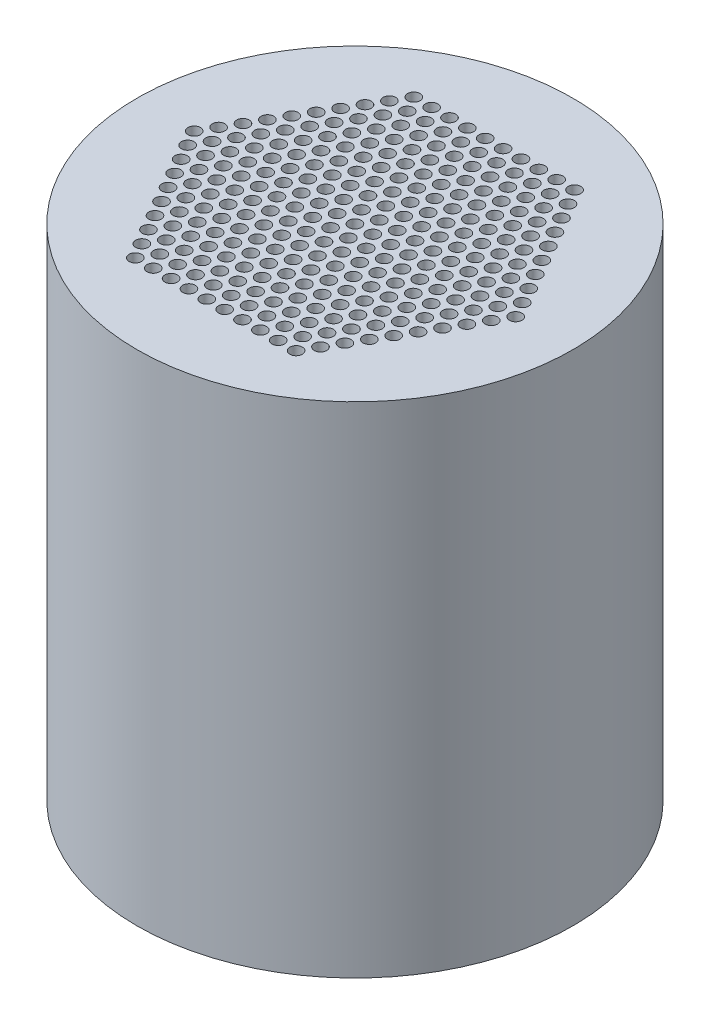
from build123d import *

# Parameters (mm, degrees)
ESBO_O1_R   = 610
AGUA_DEPTH  = 1397
ESBO_O2_R   = 17.5
VACUO_DEPTH = 1231.9


with BuildPart() as part:
    # Esboço1 → agua (new body)
    with BuildSketch(Plane(origin=(0, 0, 0), x_dir=(1, 0, 0), z_dir=(0, 1, 0))):
        Circle(ESBO_O1_R)
    extrude(amount=AGUA_DEPTH)

    # Esboço2 → vacuo (cut)
    with BuildSketch(Plane(origin=(0, 1397, 0), x_dir=(1, 0, 0), z_dir=(0, 1, 0))):
        Circle(ESBO_O2_R)
        with Locations((-25, 43.301270189)):
            Circle(ESBO_O2_R)
        with Locations((0, 86.602540378)):
            Circle(ESBO_O2_R)
        with Locations((-25, 129.903810568)):
            Circle(ESBO_O2_R)
        with Locations((25, 129.903810568)):
            Circle(ESBO_O2_R)
        with Locations((0, 173.205080757)):
            Circle(ESBO_O2_R)
        with Locations((25, 43.301270189)):
            Circle(ESBO_O2_R)
        with Locations((-25, 216.506350946)):
            Circle(ESBO_O2_R)
        with Locations((25, 216.506350946)):
            Circle(ESBO_O2_R)
        with Locations((0, 259.807621135)):
            Circle(ESBO_O2_R)
        with Locations((-25, 303.108891325)):
            Circle(ESBO_O2_R)
        with Locations((25, 303.108891325)):
            Circle(ESBO_O2_R)
        with Locations((0, 346.410161514)):
            Circle(ESBO_O2_R)
        with Locations((-25, 389.711431703)):
            Circle(ESBO_O2_R)
        with Locations((25, 389.711431703)):
            Circle(ESBO_O2_R)
        with Locations((50, 0)):
            Circle(ESBO_O2_R)
        with Locations((100, 0)):
            Circle(ESBO_O2_R)
        with Locations((150, 0)):
            Circle(ESBO_O2_R)
        with Locations((200, 0)):
            Circle(ESBO_O2_R)
        with Locations((250, 0)):
            Circle(ESBO_O2_R)
        with Locations((300, 0)):
            Circle(ESBO_O2_R)
        with Locations((350, 0)):
            Circle(ESBO_O2_R)
        with Locations((400, 0)):
            Circle(ESBO_O2_R)
        with Locations((450, 0)):
            Circle(ESBO_O2_R)
        with Locations((75, 43.301270189)):
            Circle(ESBO_O2_R)
        with Locations((50, 86.602540378)):
            Circle(ESBO_O2_R)
        with Locations((125, 43.301270189)):
            Circle(ESBO_O2_R)
        with Locations((100, 86.602540378)):
            Circle(ESBO_O2_R)
        with Locations((175, 43.301270189)):
            Circle(ESBO_O2_R)
        with Locations((150, 86.602540378)):
            Circle(ESBO_O2_R)
        with Locations((225, 43.301270189)):
            Circle(ESBO_O2_R)
        with Locations((200, 86.602540378)):
            Circle(ESBO_O2_R)
        with Locations((275, 43.301270189)):
            Circle(ESBO_O2_R)
        with Locations((250, 86.602540378)):
            Circle(ESBO_O2_R)
        with Locations((325, 43.301270189)):
            Circle(ESBO_O2_R)
        with Locations((300, 86.602540378)):
            Circle(ESBO_O2_R)
        with Locations((375, 43.301270189)):
            Circle(ESBO_O2_R)
        with Locations((350, 86.602540378)):
            Circle(ESBO_O2_R)
        with Locations((425, 43.301270189)):
            Circle(ESBO_O2_R)
        with Locations((400, 86.602540378)):
            Circle(ESBO_O2_R)
        with Locations((75, 129.903810568)):
            Circle(ESBO_O2_R)
        with Locations((50, 173.205080757)):
            Circle(ESBO_O2_R)
        with Locations((125, 129.903810568)):
            Circle(ESBO_O2_R)
        with Locations((100, 173.205080757)):
            Circle(ESBO_O2_R)
        with Locations((175, 129.903810568)):
            Circle(ESBO_O2_R)
        with Locations((150, 173.205080757)):
            Circle(ESBO_O2_R)
        with Locations((225, 129.903810568)):
            Circle(ESBO_O2_R)
        with Locations((200, 173.205080757)):
            Circle(ESBO_O2_R)
        with Locations((275, 129.903810568)):
            Circle(ESBO_O2_R)
        with Locations((250, 173.205080757)):
            Circle(ESBO_O2_R)
        with Locations((325, 129.903810568)):
            Circle(ESBO_O2_R)
        with Locations((300, 173.205080757)):
            Circle(ESBO_O2_R)
        with Locations((375, 129.903810568)):
            Circle(ESBO_O2_R)
        with Locations((350, 173.205080757)):
            Circle(ESBO_O2_R)
        with Locations((75, 216.506350946)):
            Circle(ESBO_O2_R)
        with Locations((50, 259.807621135)):
            Circle(ESBO_O2_R)
        with Locations((125, 216.506350946)):
            Circle(ESBO_O2_R)
        with Locations((100, 259.807621135)):
            Circle(ESBO_O2_R)
        with Locations((175, 216.506350946)):
            Circle(ESBO_O2_R)
        with Locations((150, 259.807621135)):
            Circle(ESBO_O2_R)
        with Locations((225, 216.506350946)):
            Circle(ESBO_O2_R)
        with Locations((200, 259.807621135)):
            Circle(ESBO_O2_R)
        with Locations((275, 216.506350946)):
            Circle(ESBO_O2_R)
        with Locations((250, 259.807621135)):
            Circle(ESBO_O2_R)
        with Locations((325, 216.506350946)):
            Circle(ESBO_O2_R)
        with Locations((300, 259.807621135)):
            Circle(ESBO_O2_R)
        with Locations((75, 303.108891325)):
            Circle(ESBO_O2_R)
        with Locations((50, 346.410161514)):
            Circle(ESBO_O2_R)
        with Locations((125, 303.108891325)):
            Circle(ESBO_O2_R)
        with Locations((100, 346.410161514)):
            Circle(ESBO_O2_R)
        with Locations((175, 303.108891325)):
            Circle(ESBO_O2_R)
        with Locations((150, 346.410161514)):
            Circle(ESBO_O2_R)
        with Locations((225, 303.108891325)):
            Circle(ESBO_O2_R)
        with Locations((200, 346.410161514)):
            Circle(ESBO_O2_R)
        with Locations((275, 303.108891325)):
            Circle(ESBO_O2_R)
        with Locations((250, 346.410161514)):
            Circle(ESBO_O2_R)
        with Locations((75, 389.711431703)):
            Circle(ESBO_O2_R)
        with Locations((125, 389.711431703)):
            Circle(ESBO_O2_R)
        with Locations((175, 389.711431703)):
            Circle(ESBO_O2_R)
        with Locations((225, 389.711431703)):
            Circle(ESBO_O2_R)
        with Locations((-225, 389.711431703)):
            Circle(ESBO_O2_R)
        with Locations((-175, 389.711431703)):
            Circle(ESBO_O2_R)
        with Locations((-125, 389.711431703)):
            Circle(ESBO_O2_R)
        with Locations((-75, 389.711431703)):
            Circle(ESBO_O2_R)
        with Locations((-250, 346.410161514)):
            Circle(ESBO_O2_R)
        with Locations((-275, 303.108891325)):
            Circle(ESBO_O2_R)
        with Locations((-200, 346.410161514)):
            Circle(ESBO_O2_R)
        with Locations((-225, 303.108891325)):
            Circle(ESBO_O2_R)
        with Locations((-150, 346.410161514)):
            Circle(ESBO_O2_R)
        with Locations((-175, 303.108891325)):
            Circle(ESBO_O2_R)
        with Locations((-100, 346.410161514)):
            Circle(ESBO_O2_R)
        with Locations((-125, 303.108891325)):
            Circle(ESBO_O2_R)
        with Locations((-50, 346.410161514)):
            Circle(ESBO_O2_R)
        with Locations((-75, 303.108891325)):
            Circle(ESBO_O2_R)
        with Locations((-300, 259.807621135)):
            Circle(ESBO_O2_R)
        with Locations((-325, 216.506350946)):
            Circle(ESBO_O2_R)
        with Locations((-250, 259.807621135)):
            Circle(ESBO_O2_R)
        with Locations((-275, 216.506350946)):
            Circle(ESBO_O2_R)
        with Locations((-200, 259.807621135)):
            Circle(ESBO_O2_R)
        with Locations((-225, 216.506350946)):
            Circle(ESBO_O2_R)
        with Locations((-150, 259.807621135)):
            Circle(ESBO_O2_R)
        with Locations((-175, 216.506350946)):
            Circle(ESBO_O2_R)
        with Locations((-100, 259.807621135)):
            Circle(ESBO_O2_R)
        with Locations((-125, 216.506350946)):
            Circle(ESBO_O2_R)
        with Locations((-50, 259.807621135)):
            Circle(ESBO_O2_R)
        with Locations((-75, 216.506350946)):
            Circle(ESBO_O2_R)
        with Locations((-350, 173.205080757)):
            Circle(ESBO_O2_R)
        with Locations((-375, 129.903810568)):
            Circle(ESBO_O2_R)
        with Locations((-300, 173.205080757)):
            Circle(ESBO_O2_R)
        with Locations((-325, 129.903810568)):
            Circle(ESBO_O2_R)
        with Locations((-250, 173.205080757)):
            Circle(ESBO_O2_R)
        with Locations((-275, 129.903810568)):
            Circle(ESBO_O2_R)
        with Locations((-200, 173.205080757)):
            Circle(ESBO_O2_R)
        with Locations((-225, 129.903810568)):
            Circle(ESBO_O2_R)
        with Locations((-150, 173.205080757)):
            Circle(ESBO_O2_R)
        with Locations((-175, 129.903810568)):
            Circle(ESBO_O2_R)
        with Locations((-100, 173.205080757)):
            Circle(ESBO_O2_R)
        with Locations((-125, 129.903810568)):
            Circle(ESBO_O2_R)
        with Locations((-50, 173.205080757)):
            Circle(ESBO_O2_R)
        with Locations((-75, 129.903810568)):
            Circle(ESBO_O2_R)
        with Locations((-400, 86.602540378)):
            Circle(ESBO_O2_R)
        with Locations((-425, 43.301270189)):
            Circle(ESBO_O2_R)
        with Locations((-350, 86.602540378)):
            Circle(ESBO_O2_R)
        with Locations((-375, 43.301270189)):
            Circle(ESBO_O2_R)
        with Locations((-300, 86.602540378)):
            Circle(ESBO_O2_R)
        with Locations((-325, 43.301270189)):
            Circle(ESBO_O2_R)
        with Locations((-250, 86.602540378)):
            Circle(ESBO_O2_R)
        with Locations((-275, 43.301270189)):
            Circle(ESBO_O2_R)
        with Locations((-200, 86.602540378)):
            Circle(ESBO_O2_R)
        with Locations((-225, 43.301270189)):
            Circle(ESBO_O2_R)
        with Locations((-150, 86.602540378)):
            Circle(ESBO_O2_R)
        with Locations((-175, 43.301270189)):
            Circle(ESBO_O2_R)
        with Locations((-100, 86.602540378)):
            Circle(ESBO_O2_R)
        with Locations((-125, 43.301270189)):
            Circle(ESBO_O2_R)
        with Locations((-50, 86.602540378)):
            Circle(ESBO_O2_R)
        with Locations((-75, 43.301270189)):
            Circle(ESBO_O2_R)
        with Locations((-450, 0)):
            Circle(ESBO_O2_R)
        with Locations((-400, 0)):
            Circle(ESBO_O2_R)
        with Locations((-350, 0)):
            Circle(ESBO_O2_R)
        with Locations((-300, 0)):
            Circle(ESBO_O2_R)
        with Locations((-250, 0)):
            Circle(ESBO_O2_R)
        with Locations((-200, 0)):
            Circle(ESBO_O2_R)
        with Locations((-150, 0)):
            Circle(ESBO_O2_R)
        with Locations((-100, 0)):
            Circle(ESBO_O2_R)
        with Locations((-50, 0)):
            Circle(ESBO_O2_R)
        with Locations((-75, -43.301270189)):
            Circle(ESBO_O2_R)
        with Locations((-50, -86.602540378)):
            Circle(ESBO_O2_R)
        with Locations((-125, -43.301270189)):
            Circle(ESBO_O2_R)
        with Locations((-100, -86.602540378)):
            Circle(ESBO_O2_R)
        with Locations((-175, -43.301270189)):
            Circle(ESBO_O2_R)
        with Locations((-150, -86.602540378)):
            Circle(ESBO_O2_R)
        with Locations((-225, -43.301270189)):
            Circle(ESBO_O2_R)
        with Locations((-200, -86.602540378)):
            Circle(ESBO_O2_R)
        with Locations((-275, -43.301270189)):
            Circle(ESBO_O2_R)
        with Locations((-250, -86.602540378)):
            Circle(ESBO_O2_R)
        with Locations((-325, -43.301270189)):
            Circle(ESBO_O2_R)
        with Locations((-300, -86.602540378)):
            Circle(ESBO_O2_R)
        with Locations((-375, -43.301270189)):
            Circle(ESBO_O2_R)
        with Locations((-350, -86.602540378)):
            Circle(ESBO_O2_R)
        with Locations((-425, -43.301270189)):
            Circle(ESBO_O2_R)
        with Locations((-400, -86.602540378)):
            Circle(ESBO_O2_R)
        with Locations((-75, -129.903810568)):
            Circle(ESBO_O2_R)
        with Locations((-50, -173.205080757)):
            Circle(ESBO_O2_R)
        with Locations((-125, -129.903810568)):
            Circle(ESBO_O2_R)
        with Locations((-100, -173.205080757)):
            Circle(ESBO_O2_R)
        with Locations((-175, -129.903810568)):
            Circle(ESBO_O2_R)
        with Locations((-150, -173.205080757)):
            Circle(ESBO_O2_R)
        with Locations((-225, -129.903810568)):
            Circle(ESBO_O2_R)
        with Locations((-200, -173.205080757)):
            Circle(ESBO_O2_R)
        with Locations((-275, -129.903810568)):
            Circle(ESBO_O2_R)
        with Locations((-250, -173.205080757)):
            Circle(ESBO_O2_R)
        with Locations((-325, -129.903810568)):
            Circle(ESBO_O2_R)
        with Locations((-300, -173.205080757)):
            Circle(ESBO_O2_R)
        with Locations((-375, -129.903810568)):
            Circle(ESBO_O2_R)
        with Locations((-350, -173.205080757)):
            Circle(ESBO_O2_R)
        with Locations((-75, -216.506350946)):
            Circle(ESBO_O2_R)
        with Locations((-50, -259.807621135)):
            Circle(ESBO_O2_R)
        with Locations((-125, -216.506350946)):
            Circle(ESBO_O2_R)
        with Locations((-100, -259.807621135)):
            Circle(ESBO_O2_R)
        with Locations((-175, -216.506350946)):
            Circle(ESBO_O2_R)
        with Locations((-150, -259.807621135)):
            Circle(ESBO_O2_R)
        with Locations((-225, -216.506350946)):
            Circle(ESBO_O2_R)
        with Locations((-200, -259.807621135)):
            Circle(ESBO_O2_R)
        with Locations((-275, -216.506350946)):
            Circle(ESBO_O2_R)
        with Locations((-250, -259.807621135)):
            Circle(ESBO_O2_R)
        with Locations((-325, -216.506350946)):
            Circle(ESBO_O2_R)
        with Locations((-300, -259.807621135)):
            Circle(ESBO_O2_R)
        with Locations((-75, -303.108891325)):
            Circle(ESBO_O2_R)
        with Locations((-50, -346.410161514)):
            Circle(ESBO_O2_R)
        with Locations((-125, -303.108891325)):
            Circle(ESBO_O2_R)
        with Locations((-100, -346.410161514)):
            Circle(ESBO_O2_R)
        with Locations((-175, -303.108891325)):
            Circle(ESBO_O2_R)
        with Locations((-150, -346.410161514)):
            Circle(ESBO_O2_R)
        with Locations((-225, -303.108891325)):
            Circle(ESBO_O2_R)
        with Locations((-200, -346.410161514)):
            Circle(ESBO_O2_R)
        with Locations((-275, -303.108891325)):
            Circle(ESBO_O2_R)
        with Locations((-250, -346.410161514)):
            Circle(ESBO_O2_R)
        with Locations((-75, -389.711431703)):
            Circle(ESBO_O2_R)
        with Locations((-125, -389.711431703)):
            Circle(ESBO_O2_R)
        with Locations((-175, -389.711431703)):
            Circle(ESBO_O2_R)
        with Locations((-225, -389.711431703)):
            Circle(ESBO_O2_R)
        with Locations((225, -389.711431703)):
            Circle(ESBO_O2_R)
        with Locations((175, -389.711431703)):
            Circle(ESBO_O2_R)
        with Locations((125, -389.711431703)):
            Circle(ESBO_O2_R)
        with Locations((75, -389.711431703)):
            Circle(ESBO_O2_R)
        with Locations((250, -346.410161514)):
            Circle(ESBO_O2_R)
        with Locations((275, -303.108891325)):
            Circle(ESBO_O2_R)
        with Locations((200, -346.410161514)):
            Circle(ESBO_O2_R)
        with Locations((225, -303.108891325)):
            Circle(ESBO_O2_R)
        with Locations((150, -346.410161514)):
            Circle(ESBO_O2_R)
        with Locations((175, -303.108891325)):
            Circle(ESBO_O2_R)
        with Locations((100, -346.410161514)):
            Circle(ESBO_O2_R)
        with Locations((125, -303.108891325)):
            Circle(ESBO_O2_R)
        with Locations((50, -346.410161514)):
            Circle(ESBO_O2_R)
        with Locations((75, -303.108891325)):
            Circle(ESBO_O2_R)
        with Locations((300, -259.807621135)):
            Circle(ESBO_O2_R)
        with Locations((325, -216.506350946)):
            Circle(ESBO_O2_R)
        with Locations((250, -259.807621135)):
            Circle(ESBO_O2_R)
        with Locations((275, -216.506350946)):
            Circle(ESBO_O2_R)
        with Locations((200, -259.807621135)):
            Circle(ESBO_O2_R)
        with Locations((225, -216.506350946)):
            Circle(ESBO_O2_R)
        with Locations((150, -259.807621135)):
            Circle(ESBO_O2_R)
        with Locations((175, -216.506350946)):
            Circle(ESBO_O2_R)
        with Locations((100, -259.807621135)):
            Circle(ESBO_O2_R)
        with Locations((125, -216.506350946)):
            Circle(ESBO_O2_R)
        with Locations((50, -259.807621135)):
            Circle(ESBO_O2_R)
        with Locations((75, -216.506350946)):
            Circle(ESBO_O2_R)
        with Locations((350, -173.205080757)):
            Circle(ESBO_O2_R)
        with Locations((375, -129.903810568)):
            Circle(ESBO_O2_R)
        with Locations((300, -173.205080757)):
            Circle(ESBO_O2_R)
        with Locations((325, -129.903810568)):
            Circle(ESBO_O2_R)
        with Locations((250, -173.205080757)):
            Circle(ESBO_O2_R)
        with Locations((275, -129.903810568)):
            Circle(ESBO_O2_R)
        with Locations((200, -173.205080757)):
            Circle(ESBO_O2_R)
        with Locations((225, -129.903810568)):
            Circle(ESBO_O2_R)
        with Locations((150, -173.205080757)):
            Circle(ESBO_O2_R)
        with Locations((175, -129.903810568)):
            Circle(ESBO_O2_R)
        with Locations((100, -173.205080757)):
            Circle(ESBO_O2_R)
        with Locations((125, -129.903810568)):
            Circle(ESBO_O2_R)
        with Locations((50, -173.205080757)):
            Circle(ESBO_O2_R)
        with Locations((75, -129.903810568)):
            Circle(ESBO_O2_R)
        with Locations((400, -86.602540378)):
            Circle(ESBO_O2_R)
        with Locations((425, -43.301270189)):
            Circle(ESBO_O2_R)
        with Locations((350, -86.602540378)):
            Circle(ESBO_O2_R)
        with Locations((375, -43.301270189)):
            Circle(ESBO_O2_R)
        with Locations((300, -86.602540378)):
            Circle(ESBO_O2_R)
        with Locations((325, -43.301270189)):
            Circle(ESBO_O2_R)
        with Locations((250, -86.602540378)):
            Circle(ESBO_O2_R)
        with Locations((275, -43.301270189)):
            Circle(ESBO_O2_R)
        with Locations((200, -86.602540378)):
            Circle(ESBO_O2_R)
        with Locations((225, -43.301270189)):
            Circle(ESBO_O2_R)
        with Locations((150, -86.602540378)):
            Circle(ESBO_O2_R)
        with Locations((175, -43.301270189)):
            Circle(ESBO_O2_R)
        with Locations((100, -86.602540378)):
            Circle(ESBO_O2_R)
        with Locations((125, -43.301270189)):
            Circle(ESBO_O2_R)
        with Locations((50, -86.602540378)):
            Circle(ESBO_O2_R)
        with Locations((75, -43.301270189)):
            Circle(ESBO_O2_R)
        with Locations((25, -389.711431703)):
            Circle(ESBO_O2_R)
        with Locations((-25, -389.711431703)):
            Circle(ESBO_O2_R)
        with Locations((0, -346.410161514)):
            Circle(ESBO_O2_R)
        with Locations((25, -303.108891325)):
            Circle(ESBO_O2_R)
        with Locations((-25, -303.108891325)):
            Circle(ESBO_O2_R)
        with Locations((0, -259.807621135)):
            Circle(ESBO_O2_R)
        with Locations((25, -216.506350946)):
            Circle(ESBO_O2_R)
        with Locations((-25, -216.506350946)):
            Circle(ESBO_O2_R)
        with Locations((25, -43.301270189)):
            Circle(ESBO_O2_R)
        with Locations((0, -173.205080757)):
            Circle(ESBO_O2_R)
        with Locations((25, -129.903810568)):
            Circle(ESBO_O2_R)
        with Locations((-25, -129.903810568)):
            Circle(ESBO_O2_R)
        with Locations((0, -86.602540378)):
            Circle(ESBO_O2_R)
        with Locations((-25, -43.301270189)):
            Circle(ESBO_O2_R)
    extrude(amount=-VACUO_DEPTH, mode=Mode.SUBTRACT)


solid = part.part
